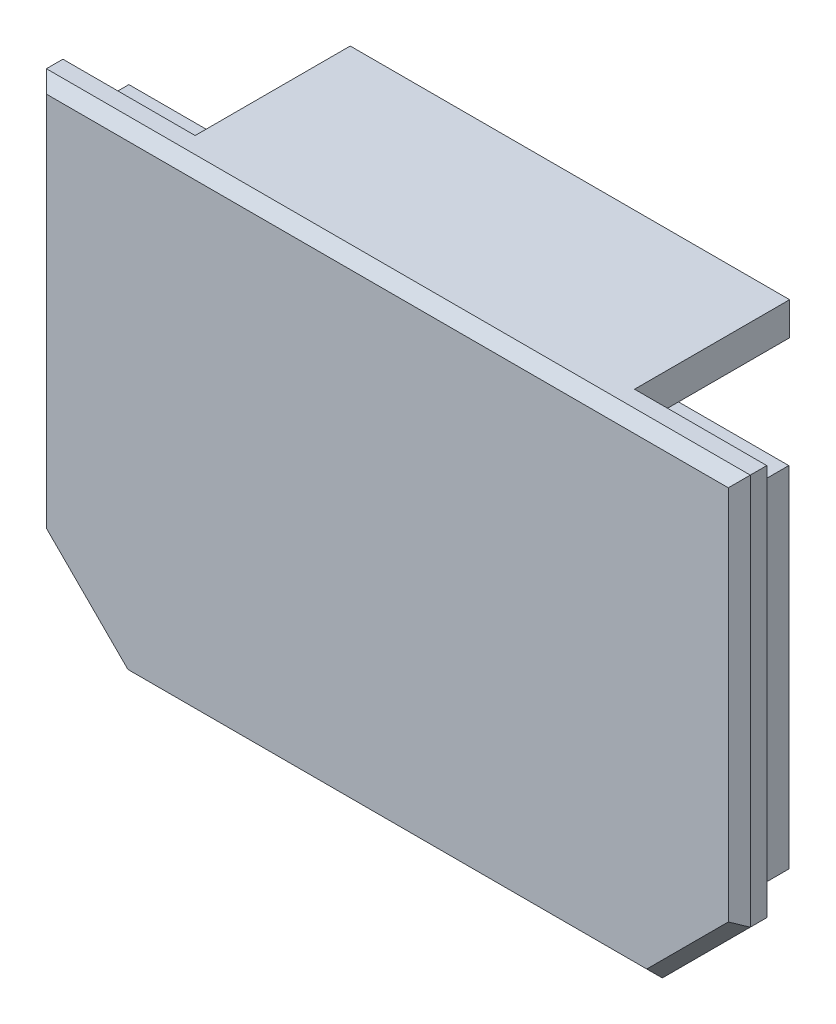
from build123d import *

# Parameters (mm, degrees)
BOSS_EXTRUDE1_DEPTH = 4
BOSS_EXTRUDE2_DEPTH = 2.5
CHAMFER1_SIZE       = 1
SKETCH4_W           = 6
SKETCH4_H           = 1.5
CUT_EXTRUDE1_DEPTH  = 2.0001
CHAMFER2_SIZE       = 1
SKETCH5_W           = 39.95
SKETCH5_H           = 3.0001
BOSS_EXTRUDE3_DEPTH = 14.1


with BuildPart() as part:
    # Sketch2 → Boss-Extrude1 (new body)
    with BuildSketch(Plane.XY):
        Polygon((-29.9999, -3.0001), (29.9999, -3.0001), (29.9999, -34.771531454), (23.171531454, -41.5999), (-23.171531454, -41.5999), (-29.9999, -34.771531454), align=None)
        Polygon((-28, -33.943145751), (-28, -5), (28, -5), (28, -33.943145751), (22.343145751, -39.6), (-22.343145751, -39.6), align=None, mode=Mode.SUBTRACT)
    extrude(amount=-BOSS_EXTRUDE1_DEPTH)

    # Sketch3 → Boss-Extrude2 (add)
    with BuildSketch(Plane.XY):
        Polygon((-32, 0), (32, 0), (32, -35.6), (24, -43.6), (-24, -43.6), (-32, -35.6), align=None)
    extrude(amount=BOSS_EXTRUDE2_DEPTH)

    # Chamfer1
    chamfer1_edges = [part.edges().sort_by_distance(p)[0] for p in [
        (-32, -17.8, 2.5),
        (-28, -39.6, 2.5),
        (0, -43.6, 2.5),
        (28, -39.6, 2.5),
        (32, -17.8, 2.5),
        (0, 0, 2.5),
    ]]
    chamfer(chamfer1_edges, length=CHAMFER1_SIZE)

    # Sketch4 → Cut-Extrude1 (cut)
    with BuildSketch(Plane.XZ.offset(43.6)):
        Rectangle(SKETCH4_W, SKETCH4_H)
    extrude(amount=-CUT_EXTRUDE1_DEPTH, mode=Mode.SUBTRACT)

    # Chamfer2
    # the kernel refuses this chamfer: 1 mm, written as the material it adds along each edge
    with BuildSketch(Plane(origin=(3, -43.6, 0.75), x_dir=(0.027495876610586487, 0, -0.9996219169112968), z_dir=(0, 1, 0))) as chamfer2_piece_1_section:
        Polygon((CHAMFER2_SIZE * 0.999621916911, CHAMFER2_SIZE * 0.0274958766106), (-CHAMFER2_SIZE * 0.0274958766106, CHAMFER2_SIZE * 0.999621916911), (0, 0), align=None)
    chamfer2_piece_1 = extrude(amount=4.571782988, mode=Mode.PRIVATE)
    chamfer2_piece_1 = split(chamfer2_piece_1, bisect_by=Plane(origin=(2.65, -42.59995, 0), z_dir=(0, 0, 1)), keep=Keep.TOP, mode=Mode.PRIVATE)
    add(chamfer2_piece_1)
    with BuildSketch(Plane(origin=(-3, -43.6, 0.75), x_dir=(-0.027495876610586487, 0, -0.9996219169112968), z_dir=(0, 1, 0))) as chamfer2_piece_2_section:
        Polygon((CHAMFER2_SIZE * 0.999621916911, -CHAMFER2_SIZE * 0.0274958766106), (-CHAMFER2_SIZE * 0.0274958766106, -CHAMFER2_SIZE * 0.999621916911), (0, 0), align=None)
    chamfer2_piece_2 = extrude(amount=4.571782988, mode=Mode.PRIVATE)
    chamfer2_piece_2 = split(chamfer2_piece_2, bisect_by=Plane(origin=(-2.65, -42.59995, 0), z_dir=(0, 0, 1)), keep=Keep.TOP, mode=Mode.PRIVATE)
    add(chamfer2_piece_2)

    # Sketch5 → Boss-Extrude3 (add)
    with BuildSketch(Plane(origin=(0, 0, 0), x_dir=(-1, 0, 0), z_dir=(0, 0, -1))):
        with Locations((0, -1.50005)):
            Rectangle(SKETCH5_W, SKETCH5_H)
    extrude(amount=BOSS_EXTRUDE3_DEPTH)


solid = part.part
